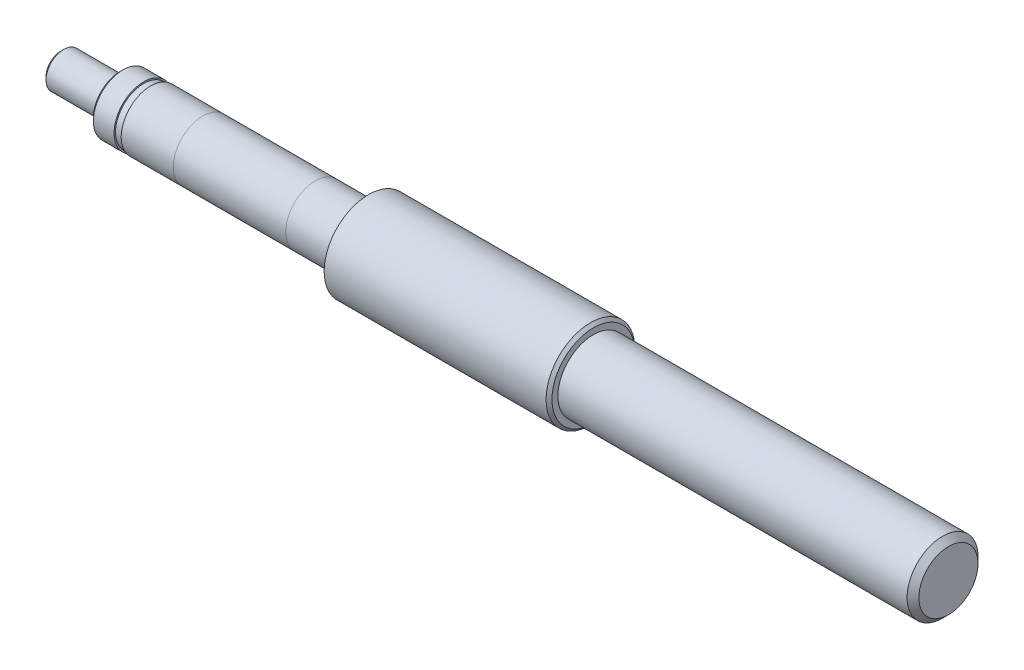
from build123d import *


with BuildPart() as part:
    # Skizze1 → Rotation1 (revolve)
    with BuildSketch(Plane(origin=(0, 0, 0), x_dir=(1, 0, 0), z_dir=(0, 1, 0))):
        with BuildLine():
            Line((-7, 2.5), (-7, 0))
            Line((-7, 0), (143, 0))
            Line((143, 0), (143, 5))
            Line((143, 5), (142, 6))
            Line((142, 6), (83, 6))
            Line((83, 6), (83, 7))
            Line((83, 7), (82.5, 7.5))
            Line((82.5, 7.5), (45, 7.5))
            Line((45, 7.5), (45, 5.15))
            ThreePointArc((45, 5.15), (44.912132034, 4.937867966), (44.7, 4.85))
            Line((44.7, 4.85), (44.082842712, 4.85))
            ThreePointArc((44.082842712, 4.85), (44.006306026, 4.865224093), (43.941421356, 4.908578644))
            Line((43.941421356, 4.908578644), (43.85, 5))
            Line((43.85, 5), (8.2, 5))
            Line((8.2, 5), (8.055662433, 4.75))
            Line((8.055662433, 4.75), (7, 4.75))
            Line((7, 4.75), (7, 5))
            Line((7, 5), (3.5, 5))
            Line((3.5, 5), (3, 4.5))
            Line((3, 4.5), (3, 3))
            Line((3, 3), (-6.5, 3))
            Line((-6.5, 3), (-7, 2.5))
        make_face()
    revolve(axis=Axis((65, 0, 0), (1, 0, 0)))


solid = part.part
